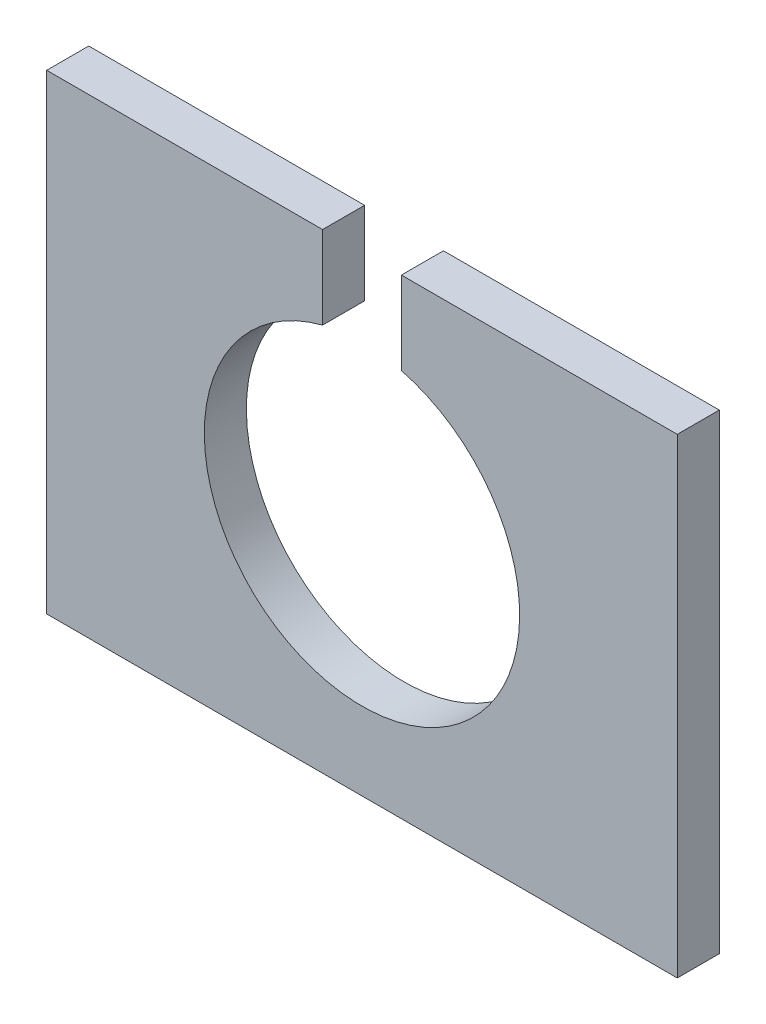
from build123d import *

# Parameters (mm, degrees)
SKETCH1_W           = 38.1
SKETCH1_H           = 28.448
BOSS_EXTRUDE1_DEPTH = 2.54
CUT_EXTRUDE2_REACH  = 49.617


with BuildPart() as part:
    # Sketch1 → Boss-Extrude1 (new body)
    with BuildSketch(Plane.XY):
        with Locations((19.05, 14.224)):
            Rectangle(SKETCH1_W, SKETCH1_H)
    extrude(amount=-BOSS_EXTRUDE1_DEPTH)

    # Sketch3 → Cut-Extrude2 (cut, up to next)
    with BuildSketch(Plane.XY, mode=Mode.PRIVATE) as cut_extrude2_sk1:
        with BuildLine():
            ThreePointArc((16.66875, 23.446541593), (19.05, 4.699), (21.43125, 23.446541593))
            Line((21.43125, 23.446541593), (21.43125, 28.448))
            Line((21.43125, 28.448), (16.66875, 28.448))
            Line((16.66875, 28.448), (16.66875, 23.446541593))
        make_face()
    cut_extrude2_tool1 = extrude(cut_extrude2_sk1.sketch, amount=-CUT_EXTRUDE2_REACH, mode=Mode.PRIVATE) & part.part
    add(cut_extrude2_tool1.solids().sort_by_distance((19.05, 15.101748, 0))[0], mode=Mode.SUBTRACT)


solid = part.part
